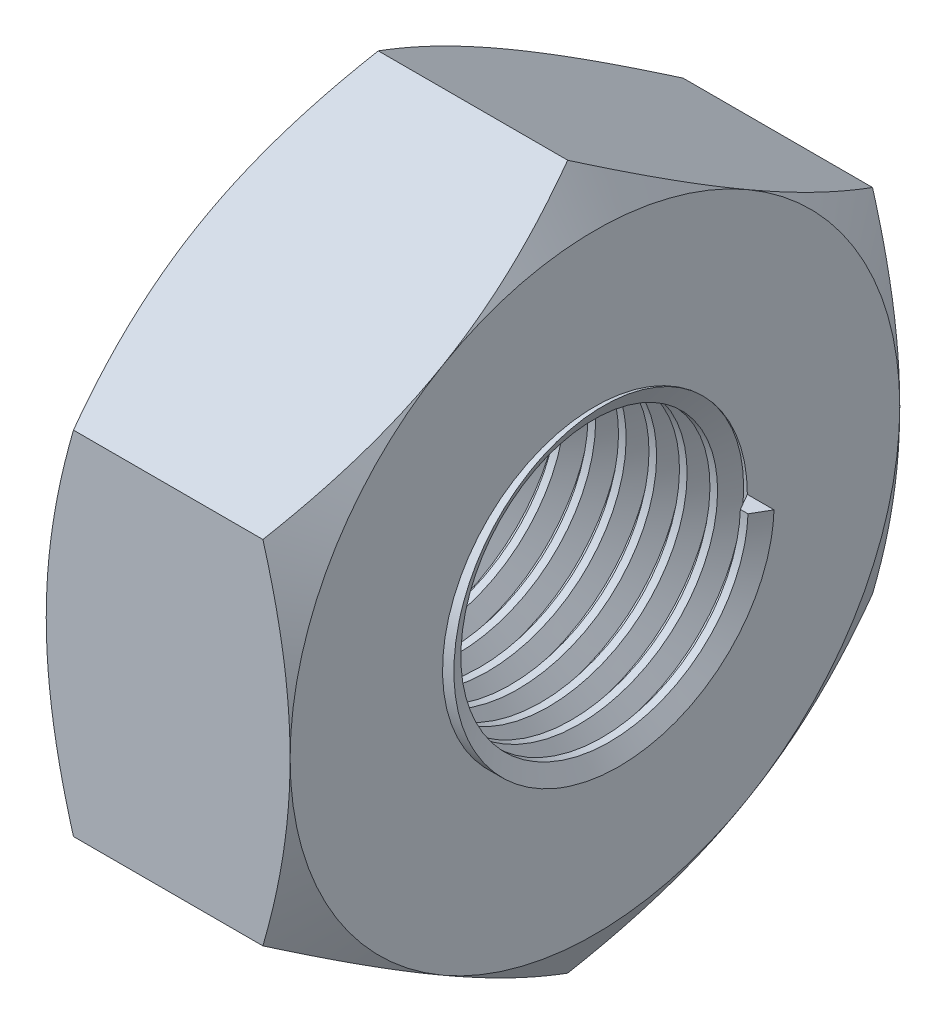
from build123d import *

# Parameters (mm, degrees)
SKETCH1_R               = 5
BOSS_EXTRUDE1_DEPTH     = 4
SKETCH2_OUTSIDE_W       = 91.512
SKETCH2_OUTSIDE_H       = 94.606
SKETCH2_OUTSIDE_R       = 10
CUT_EXTRUDE1_DEPTH      = 18.243356209
CUT_EXTRUDE1_DRAFT      = -60
MIRROR1_COPY_1_SKETCH_W = 91.512
MIRROR1_COPY_1_SKETCH_H = 94.606
MIRROR1_COPY_1_SKETCH_R = 10
MIRROR1_COPY_1_DEPTH    = 18.243356209
MIRROR1_COPY_1_DRAFT    = -60
THREAD2_PITCH           = 1


with BuildPart() as part:
    # Sketch1 → Boss-Extrude1 (new, symmetric)
    with BuildSketch(Plane(origin=(0, 0, 0), x_dir=(0, 0, -1), z_dir=(1, 0, 0))):
        Polygon((0, 11.547005384), (-10, 5.773502692), (-10, -5.773502692), (0, -11.547005384), (10, -5.773502692), (10, 5.773502692), align=None)
        Circle(SKETCH1_R, mode=Mode.SUBTRACT)
    extrude(amount=BOSS_EXTRUDE1_DEPTH, both=True)


with BuildPart() as cut_extrude1_tool:
    # Sketch2 outside → Cut-Extrude1 (with draft: the straight prism first)
    with BuildSketch(Plane(origin=(4, 0, 0), x_dir=(0, 0, -1), z_dir=(1, 0, 0))):
        Rectangle(SKETCH2_OUTSIDE_W, SKETCH2_OUTSIDE_H)
        Circle(SKETCH2_OUTSIDE_R, mode=Mode.SUBTRACT)
    extrude(amount=-CUT_EXTRUDE1_DEPTH)
    # Cut-Extrude1: the draft: its side faces are tilted about the plane it starts from
    cut_extrude1_sides = [cut_extrude1_tool.faces().sort_by_distance(p)[0] for p in [
        (-5.121678104, -47.303, 0),
        (-5.121678104, 0, -45.756),
        (-5.121678104, 47.303, 0),
        (-5.121678104, 0, 45.756),
        (-5.121678104, 0, 10),
    ]]
    draft(cut_extrude1_sides, Plane(origin=(4, 0, 0), x_dir=(0, 0, -1), z_dir=(1, 0, 0)), CUT_EXTRUDE1_DRAFT)


with BuildPart() as part_1:
    add(part.part)

    # Cut-Extrude1: cut by cut_extrude1_tool
    add(cut_extrude1_tool.part, mode=Mode.SUBTRACT)


with BuildPart() as mirror1_copy_1_tool:
    # Mirror1 copy 1 sketch → Mirror1 copy 1 (with draft: the straight prism first)
    with BuildSketch(Plane(origin=(-4, 0, 0), x_dir=(0, 0, -1), z_dir=(-1, 0, 0))):
        Rectangle(MIRROR1_COPY_1_SKETCH_W, MIRROR1_COPY_1_SKETCH_H)
        Circle(MIRROR1_COPY_1_SKETCH_R, mode=Mode.SUBTRACT)
    extrude(amount=-MIRROR1_COPY_1_DEPTH)
    # Mirror1 copy 1: the draft: its side faces are tilted about the plane it starts from
    mirror1_copy_1_sides = [mirror1_copy_1_tool.faces().sort_by_distance(p)[0] for p in [
        (5.121678104, -47.303, 0),
        (5.121678104, 0, -45.756),
        (5.121678104, 47.303, 0),
        (5.121678104, 0, 45.756),
        (5.121678104, 0, 10),
    ]]
    draft(mirror1_copy_1_sides, Plane(origin=(-4, 0, 0), x_dir=(0, 0, -1), z_dir=(-1, 0, 0)), MIRROR1_COPY_1_DRAFT)


with BuildPart() as part_2:
    add(part_1.part)

    # Mirror1 copy 1: cut by mirror1_copy_1_tool
    add(mirror1_copy_1_tool.part, mode=Mode.SUBTRACT)

    # Thread2: the profile of Thread Profile2 profile screwed along a right-hand helix of 8 turns, 8 arcs to a turn; built about Z, then put on its axis
    thread2_z = Axis((0, 0, 0), (0, 0, 1))
    thread2_corners = [(5.0003, 0, -0.000173205), (5.0003, 0, 0.875173202), (4.458734125, 0, 0.562499999), (4.458734125, 0, 0.312499999)]
    with BuildLine(mode=Mode.PRIVATE) as thread2_profile:
        Line(thread2_corners[0], thread2_corners[1])
        Line(thread2_corners[1], thread2_corners[2])
        Line(thread2_corners[2], thread2_corners[3])
        Line(thread2_corners[3], thread2_corners[0])
    thread2_cap = Face(thread2_profile.wire())
    thread2_turn_angles = [0, 22.5, 45, 67.5, 90, 112.5, 135, 157.5, 180, 202.5, 225, 247.5, 270, 292.5, 315, 337.5, 360]
    thread2_turn_weights = [1, 0.9238795325112867, 1, 0.9238795325112867, 1, 0.9238795325112867, 1, 0.9238795325112867, 1, 0.9238795325112867, 1, 0.9238795325112867, 1, 0.9238795325112867, 1, 0.9238795325112867, 1]
    thread2_turn_rails = [Edge.make_bspline([Vector(p[0], p[1], 0).rotate(thread2_z, thread2_turn_angles[k]) / thread2_turn_weights[k] + Vector(0, 0, p[2] + THREAD2_PITCH * thread2_turn_angles[k] / 360) for k in range(17)], [0, 0, 0, 1, 1, 2, 2, 3, 3, 4, 4, 5, 5, 6, 6, 7, 7, 8, 8, 8], 2, thread2_turn_weights) for p in thread2_corners]
    thread2_turn_sides = [Face.make_surface_from_curves(thread2_turn_rails[p[0]], thread2_turn_rails[p[1]]) for p in [(0, 1), (1, 2), (2, 3), (3, 0)]]
    thread2 = Plane(origin=(-4, 0, 0), x_dir=(0, 0, -1), z_dir=(1, 0, 0)) * Solid(Shell([*[p.moved(Location((0, 0, THREAD2_PITCH * i))) for i in range(8) for p in thread2_turn_sides], thread2_cap, thread2_cap.rotate(thread2_z, 2880).moved(Location((0, 0, THREAD2_PITCH * 2880 / 360)))]))
    add(thread2)


solid = part_2.part
